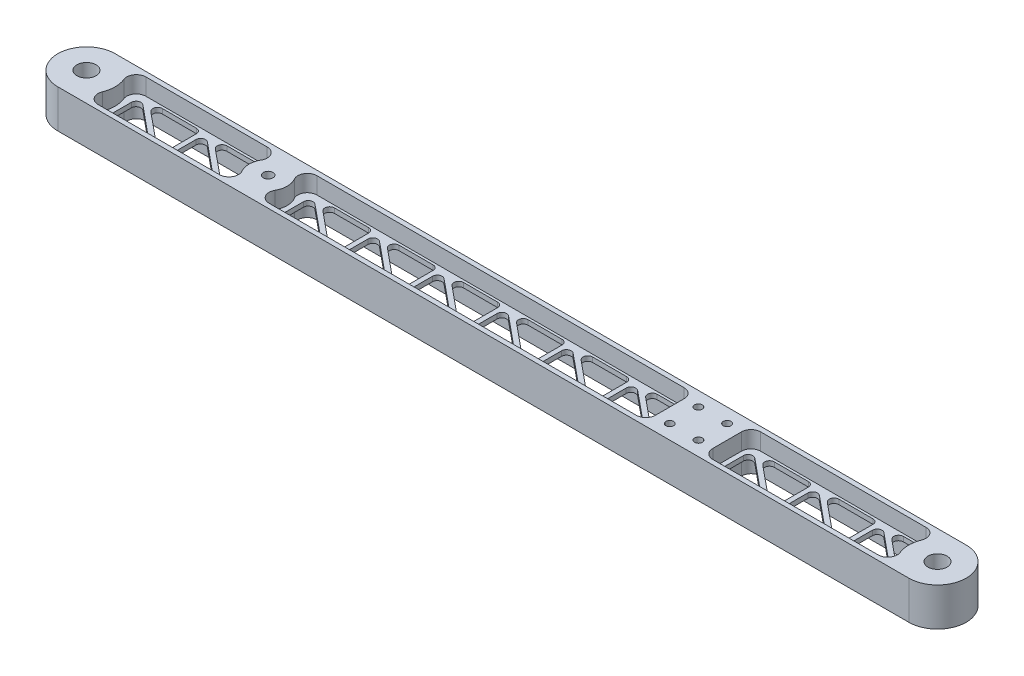
from build123d import *

# Parameters (mm, degrees)
SKETCH2_R                   = 6.35
SKETCH2_R_2                 = 3.175
BOSS_EXTRUDE1_DEPTH         = 25.4
CUT_EXTRUDE2_REACH          = 587.992
CUT_EXTRUDE3_DEPTH          = 11.1125
FILLET1_R                   = 3.175
F_1_4_20_TAPPED_HOLE1_D     = 5.1054
F_1_4_20_TAPPED_HOLE1_DEPTH = 19.05
F_1_4_20_TAPPED_HOLE1_TIP   = 1.533816902
FILLET3_R                   = 3.175
FILLET4_R                   = 3.175
FILLET5_R                   = 6.35
FILLET6_R                   = 3.175


with BuildPart() as part:
    # Sketch2 → Boss-Extrude1 (new body)
    with BuildSketch(Plane(origin=(0, 0, 0), x_dir=(1, 0, 0), z_dir=(0, 1, 0))):
        with BuildLine():
            ThreePointArc((0, 38.1), (-19.05, 19.05), (0, 0))
            Line((0, 0), (565.15, 0))
            ThreePointArc((565.15, 0), (584.2, 19.05), (565.15, 38.1))
            Line((565.15, 38.1), (0, 38.1))
        make_face()
        with Locations(Location((0, 19.05, 0), (0, 0, 270))):
            Circle(SKETCH2_R, mode=Mode.SUBTRACT)
        with Locations(Location((120.65, 19.05, 0), (0, 0, 270))):
            Circle(SKETCH2_R_2, mode=Mode.SUBTRACT)
        with Locations(Location((565.15, 19.05, 0), (0, 0, 270))):
            Circle(SKETCH2_R, mode=Mode.SUBTRACT)
    extrude(amount=BOSS_EXTRUDE1_DEPTH)

    # Sketch13 → Cut-Extrude2 (cut, up to next)
    with BuildSketch(Plane(origin=(0, 25.4, 0), x_dir=(1, 0, 0), z_dir=(0, 1, 0)), mode=Mode.PRIVATE) as cut_extrude2_sk1:
        Polygon((56.91846966, 4.7625), (22.225, 33.3375), (22.225, 4.7625), align=None)
    cut_extrude2_tool1 = extrude(cut_extrude2_sk1.sketch, amount=-CUT_EXTRUDE2_REACH, mode=Mode.PRIVATE) & part.part
    # Sketch13 → Cut-Extrude2 (cut, up to next)
    with BuildSketch(Plane(origin=(0, 25.4, 0), x_dir=(1, 0, 0), z_dir=(0, 1, 0)), mode=Mode.PRIVATE) as cut_extrude2_sk2:
        Polygon((61.9125, 33.3375), (27.21903034, 33.3375), (61.9125, 4.7625), align=None)
    cut_extrude2_tool2 = extrude(cut_extrude2_sk2.sketch, amount=-CUT_EXTRUDE2_REACH, mode=Mode.PRIVATE) & part.part
    # Sketch13 → Cut-Extrude2 (cut, up to next)
    with BuildSketch(Plane(origin=(0, 25.4, 0), x_dir=(1, 0, 0), z_dir=(0, 1, 0)), mode=Mode.PRIVATE) as cut_extrude2_sk3:
        Polygon((99.78096966, 4.7625), (65.0875, 33.3375), (65.0875, 4.7625), align=None)
    cut_extrude2_tool3 = extrude(cut_extrude2_sk3.sketch, amount=-CUT_EXTRUDE2_REACH, mode=Mode.PRIVATE) & part.part
    # Sketch13 → Cut-Extrude2 (cut, up to next)
    with BuildSketch(Plane(origin=(0, 25.4, 0), x_dir=(1, 0, 0), z_dir=(0, 1, 0)), mode=Mode.PRIVATE) as cut_extrude2_sk4:
        Polygon((104.775, 33.3375), (70.08153034, 33.3375), (104.775, 4.7625), align=None)
    cut_extrude2_tool4 = extrude(cut_extrude2_sk4.sketch, amount=-CUT_EXTRUDE2_REACH, mode=Mode.PRIVATE) & part.part
    # Sketch13 → Cut-Extrude2 (cut, up to next)
    with BuildSketch(Plane(origin=(0, 25.4, 0), x_dir=(1, 0, 0), z_dir=(0, 1, 0)), mode=Mode.PRIVATE) as cut_extrude2_sk5:
        Polygon((384.175, 5.879333612), (350.8375, 33.3375), (350.8375, 4.7625), (384.175, 4.7625), align=None)
    cut_extrude2_tool5 = extrude(cut_extrude2_sk5.sketch, amount=-CUT_EXTRUDE2_REACH, mode=Mode.PRIVATE) & part.part
    # Sketch13 → Cut-Extrude2 (cut, up to next)
    with BuildSketch(Plane(origin=(0, 25.4, 0), x_dir=(1, 0, 0), z_dir=(0, 1, 0)), mode=Mode.PRIVATE) as cut_extrude2_sk6:
        Polygon((384.175, 33.3375), (355.83153034, 33.3375), (384.175, 9.992626931), align=None)
    cut_extrude2_tool6 = extrude(cut_extrude2_sk6.sketch, amount=-CUT_EXTRUDE2_REACH, mode=Mode.PRIVATE) & part.part
    # Sketch13 → Cut-Extrude2 (cut, up to next)
    with BuildSketch(Plane(origin=(0, 25.4, 0), x_dir=(1, 0, 0), z_dir=(0, 1, 0)), mode=Mode.PRIVATE) as cut_extrude2_sk7:
        Polygon((171.21846966, 4.7625), (136.525, 33.3375), (136.525, 4.7625), align=None)
    cut_extrude2_tool7 = extrude(cut_extrude2_sk7.sketch, amount=-CUT_EXTRUDE2_REACH, mode=Mode.PRIVATE) & part.part
    # Sketch13 → Cut-Extrude2 (cut, up to next)
    with BuildSketch(Plane(origin=(0, 25.4, 0), x_dir=(1, 0, 0), z_dir=(0, 1, 0)), mode=Mode.PRIVATE) as cut_extrude2_sk8:
        Polygon((176.2125, 33.3375), (141.51903034, 33.3375), (176.2125, 4.7625), align=None)
    cut_extrude2_tool8 = extrude(cut_extrude2_sk8.sketch, amount=-CUT_EXTRUDE2_REACH, mode=Mode.PRIVATE) & part.part
    # Sketch13 → Cut-Extrude2 (cut, up to next)
    with BuildSketch(Plane(origin=(0, 25.4, 0), x_dir=(1, 0, 0), z_dir=(0, 1, 0)), mode=Mode.PRIVATE) as cut_extrude2_sk9:
        Polygon((214.08096966, 4.7625), (179.3875, 33.3375), (179.3875, 4.7625), align=None)
    cut_extrude2_tool9 = extrude(cut_extrude2_sk9.sketch, amount=-CUT_EXTRUDE2_REACH, mode=Mode.PRIVATE) & part.part
    # Sketch13 → Cut-Extrude2 (cut, up to next)
    with BuildSketch(Plane(origin=(0, 25.4, 0), x_dir=(1, 0, 0), z_dir=(0, 1, 0)), mode=Mode.PRIVATE) as cut_extrude2_sk10:
        Polygon((219.075, 33.3375), (184.38153034, 33.3375), (219.075, 4.7625), align=None)
    cut_extrude2_tool10 = extrude(cut_extrude2_sk10.sketch, amount=-CUT_EXTRUDE2_REACH, mode=Mode.PRIVATE) & part.part
    # Sketch13 → Cut-Extrude2 (cut, up to next)
    with BuildSketch(Plane(origin=(0, 25.4, 0), x_dir=(1, 0, 0), z_dir=(0, 1, 0)), mode=Mode.PRIVATE) as cut_extrude2_sk11:
        Polygon((256.94346966, 4.7625), (222.25, 33.3375), (222.25, 4.7625), align=None)
    cut_extrude2_tool11 = extrude(cut_extrude2_sk11.sketch, amount=-CUT_EXTRUDE2_REACH, mode=Mode.PRIVATE) & part.part
    # Sketch13 → Cut-Extrude2 (cut, up to next)
    with BuildSketch(Plane(origin=(0, 25.4, 0), x_dir=(1, 0, 0), z_dir=(0, 1, 0)), mode=Mode.PRIVATE) as cut_extrude2_sk12:
        Polygon((261.9375, 33.3375), (227.24403034, 33.3375), (261.9375, 4.7625), align=None)
    cut_extrude2_tool12 = extrude(cut_extrude2_sk12.sketch, amount=-CUT_EXTRUDE2_REACH, mode=Mode.PRIVATE) & part.part
    # Sketch13 → Cut-Extrude2 (cut, up to next)
    with BuildSketch(Plane(origin=(0, 25.4, 0), x_dir=(1, 0, 0), z_dir=(0, 1, 0)), mode=Mode.PRIVATE) as cut_extrude2_sk13:
        Polygon((299.80596966, 4.7625), (265.1125, 33.3375), (265.1125, 4.7625), align=None)
    cut_extrude2_tool13 = extrude(cut_extrude2_sk13.sketch, amount=-CUT_EXTRUDE2_REACH, mode=Mode.PRIVATE) & part.part
    # Sketch13 → Cut-Extrude2 (cut, up to next)
    with BuildSketch(Plane(origin=(0, 25.4, 0), x_dir=(1, 0, 0), z_dir=(0, 1, 0)), mode=Mode.PRIVATE) as cut_extrude2_sk14:
        Polygon((304.8, 33.3375), (270.10653034, 33.3375), (304.8, 4.7625), align=None)
    cut_extrude2_tool14 = extrude(cut_extrude2_sk14.sketch, amount=-CUT_EXTRUDE2_REACH, mode=Mode.PRIVATE) & part.part
    # Sketch13 → Cut-Extrude2 (cut, up to next)
    with BuildSketch(Plane(origin=(0, 25.4, 0), x_dir=(1, 0, 0), z_dir=(0, 1, 0)), mode=Mode.PRIVATE) as cut_extrude2_sk15:
        Polygon((342.66846966, 4.7625), (307.975, 33.3375), (307.975, 4.7625), align=None)
    cut_extrude2_tool15 = extrude(cut_extrude2_sk15.sketch, amount=-CUT_EXTRUDE2_REACH, mode=Mode.PRIVATE) & part.part
    # Sketch13 → Cut-Extrude2 (cut, up to next)
    with BuildSketch(Plane(origin=(0, 25.4, 0), x_dir=(1, 0, 0), z_dir=(0, 1, 0)), mode=Mode.PRIVATE) as cut_extrude2_sk16:
        Polygon((347.6625, 33.3375), (312.96903034, 33.3375), (347.6625, 4.7625), align=None)
    cut_extrude2_tool16 = extrude(cut_extrude2_sk16.sketch, amount=-CUT_EXTRUDE2_REACH, mode=Mode.PRIVATE) & part.part
    # Sketch13 → Cut-Extrude2 (cut, up to next)
    with BuildSketch(Plane(origin=(0, 25.4, 0), x_dir=(1, 0, 0), z_dir=(0, 1, 0)), mode=Mode.PRIVATE) as cut_extrude2_sk17:
        with BuildLine():
            ThreePointArc((543.684455535, 13.289702626), (543.4511385, 23.857289738), (548.125959095, 33.3375))
            Line((548.125959095, 33.3375), (519.34403034, 33.3375))
            Line((519.34403034, 33.3375), (543.684455535, 13.289702626))
        make_face()
    cut_extrude2_tool17 = extrude(cut_extrude2_sk17.sketch, amount=-CUT_EXTRUDE2_REACH, mode=Mode.PRIVATE) & part.part
    # Sketch13 → Cut-Extrude2 (cut, up to next)
    with BuildSketch(Plane(origin=(0, 25.4, 0), x_dir=(1, 0, 0), z_dir=(0, 1, 0)), mode=Mode.PRIVATE) as cut_extrude2_sk18:
        with BuildLine():
            ThreePointArc((548.125959095, 4.7625), (547.360233209, 5.728032333), (546.649199715, 6.734521373))
            Line((546.649199715, 6.734521373), (514.35, 33.3375))
            Line((514.35, 33.3375), (514.35, 4.7625))
            Line((514.35, 4.7625), (548.125959095, 4.7625))
        make_face()
    cut_extrude2_tool18 = extrude(cut_extrude2_sk18.sketch, amount=-CUT_EXTRUDE2_REACH, mode=Mode.PRIVATE) & part.part
    # Sketch13 → Cut-Extrude2 (cut, up to next)
    with BuildSketch(Plane(origin=(0, 25.4, 0), x_dir=(1, 0, 0), z_dir=(0, 1, 0)), mode=Mode.PRIVATE) as cut_extrude2_sk19:
        Polygon((463.31846966, 4.7625), (428.625, 33.3375), (428.625, 4.7625), align=None)
    cut_extrude2_tool19 = extrude(cut_extrude2_sk19.sketch, amount=-CUT_EXTRUDE2_REACH, mode=Mode.PRIVATE) & part.part
    # Sketch13 → Cut-Extrude2 (cut, up to next)
    with BuildSketch(Plane(origin=(0, 25.4, 0), x_dir=(1, 0, 0), z_dir=(0, 1, 0)), mode=Mode.PRIVATE) as cut_extrude2_sk20:
        Polygon((468.3125, 33.3375), (433.61903034, 33.3375), (468.3125, 4.7625), align=None)
    cut_extrude2_tool20 = extrude(cut_extrude2_sk20.sketch, amount=-CUT_EXTRUDE2_REACH, mode=Mode.PRIVATE) & part.part
    # Sketch13 → Cut-Extrude2 (cut, up to next)
    with BuildSketch(Plane(origin=(0, 25.4, 0), x_dir=(1, 0, 0), z_dir=(0, 1, 0)), mode=Mode.PRIVATE) as cut_extrude2_sk21:
        Polygon((506.18096966, 4.7625), (471.4875, 33.3375), (471.4875, 4.7625), align=None)
    cut_extrude2_tool21 = extrude(cut_extrude2_sk21.sketch, amount=-CUT_EXTRUDE2_REACH, mode=Mode.PRIVATE) & part.part
    # Sketch13 → Cut-Extrude2 (cut, up to next)
    with BuildSketch(Plane(origin=(0, 25.4, 0), x_dir=(1, 0, 0), z_dir=(0, 1, 0)), mode=Mode.PRIVATE) as cut_extrude2_sk22:
        Polygon((511.175, 33.3375), (476.48153034, 33.3375), (511.175, 4.7625), align=None)
    cut_extrude2_tool22 = extrude(cut_extrude2_sk22.sketch, amount=-CUT_EXTRUDE2_REACH, mode=Mode.PRIVATE) & part.part
    add(cut_extrude2_tool1.solids().sort_by_distance((33.78949, 25.4, -14.2875))[0], mode=Mode.SUBTRACT)
    add(cut_extrude2_tool2.solids().sort_by_distance((50.34801, 25.4, -23.8125))[0], mode=Mode.SUBTRACT)
    add(cut_extrude2_tool3.solids().sort_by_distance((76.65199, 25.4, -14.2875))[0], mode=Mode.SUBTRACT)
    add(cut_extrude2_tool4.solids().sort_by_distance((93.21051, 25.4, -23.8125))[0], mode=Mode.SUBTRACT)
    add(cut_extrude2_tool5.solids().sort_by_distance((362.367987, 25.4, -14.301503))[0], mode=Mode.SUBTRACT)
    add(cut_extrude2_tool6.solids().sort_by_distance((374.727177, 25.4, -25.555876))[0], mode=Mode.SUBTRACT)
    add(cut_extrude2_tool7.solids().sort_by_distance((148.08949, 25.4, -14.2875))[0], mode=Mode.SUBTRACT)
    add(cut_extrude2_tool8.solids().sort_by_distance((164.64801, 25.4, -23.8125))[0], mode=Mode.SUBTRACT)
    add(cut_extrude2_tool9.solids().sort_by_distance((190.95199, 25.4, -14.2875))[0], mode=Mode.SUBTRACT)
    add(cut_extrude2_tool10.solids().sort_by_distance((207.51051, 25.4, -23.8125))[0], mode=Mode.SUBTRACT)
    add(cut_extrude2_tool11.solids().sort_by_distance((233.81449, 25.4, -14.2875))[0], mode=Mode.SUBTRACT)
    add(cut_extrude2_tool12.solids().sort_by_distance((250.37301, 25.4, -23.8125))[0], mode=Mode.SUBTRACT)
    add(cut_extrude2_tool13.solids().sort_by_distance((276.67699, 25.4, -14.2875))[0], mode=Mode.SUBTRACT)
    add(cut_extrude2_tool14.solids().sort_by_distance((293.23551, 25.4, -23.8125))[0], mode=Mode.SUBTRACT)
    add(cut_extrude2_tool15.solids().sort_by_distance((319.53949, 25.4, -14.2875))[0], mode=Mode.SUBTRACT)
    add(cut_extrude2_tool16.solids().sort_by_distance((336.09801, 25.4, -23.8125))[0], mode=Mode.SUBTRACT)
    add(cut_extrude2_tool17.solids().sort_by_distance((535.971737, 25.4, -27.083486))[0], mode=Mode.SUBTRACT)
    add(cut_extrude2_tool18.solids().sort_by_distance((525.871779, 25.4, -14.304685))[0], mode=Mode.SUBTRACT)
    add(cut_extrude2_tool19.solids().sort_by_distance((440.18949, 25.4, -14.2875))[0], mode=Mode.SUBTRACT)
    add(cut_extrude2_tool20.solids().sort_by_distance((456.74801, 25.4, -23.8125))[0], mode=Mode.SUBTRACT)
    add(cut_extrude2_tool21.solids().sort_by_distance((483.05199, 25.4, -14.2875))[0], mode=Mode.SUBTRACT)
    add(cut_extrude2_tool22.solids().sort_by_distance((499.61051, 25.4, -23.8125))[0], mode=Mode.SUBTRACT)

    # Sketch13<4> → Cut-Extrude3 (cut)
    # profile 1 of 3: a face of its own
    with BuildSketch(Plane(origin=(0, 25.4, 0), x_dir=(1, 0, 0), z_dir=(0, 1, 0))):
        with BuildLine():
            ThreePointArc((109.651477372, 25.4), (109.651477372, 31.75), (104.152216058, 34.925))
            Line((104.152216058, 34.925), (10.530283709, 34.925))
            ThreePointArc((10.530283709, 34.925), (16.785475934, 28.058346001), (19.05, 19.05))
            ThreePointArc((19.05, 19.05), (16.785475934, 10.041653999), (10.530283709, 3.175))
            Line((10.530283709, 3.175), (104.152216058, 3.175))
            ThreePointArc((104.152216058, 3.175), (109.651477372, 6.35), (109.651477372, 12.7))
            ThreePointArc((109.651477372, 12.7), (107.95, 19.05), (109.651477372, 25.4))
        make_face()
        Polygon((22.225, 4.7625), (22.225, 33.3375), (56.91846966, 4.7625), align=None, mode=Mode.SUBTRACT)
        Polygon((61.9125, 4.7625), (27.21903034, 33.3375), (61.9125, 33.3375), align=None, mode=Mode.SUBTRACT)
        Polygon((65.0875, 4.7625), (65.0875, 33.3375), (99.78096966, 4.7625), align=None, mode=Mode.SUBTRACT)
        Polygon((104.775, 4.7625), (70.08153034, 33.3375), (104.775, 33.3375), align=None, mode=Mode.SUBTRACT)
    # profile 2 of 3: a face of its own
    with BuildSketch(Plane(origin=(0, 25.4, 0), x_dir=(1, 0, 0), z_dir=(0, 1, 0))):
        with BuildLine():
            Line((554.619716291, 34.925), (425.45, 34.925))
            Line((425.45, 34.925), (425.45, 3.175))
            Line((425.45, 3.175), (550.970884641, 3.175))
            Line((550.970884641, 3.175), (554.619716291, 3.175))
            ThreePointArc((554.619716291, 3.175), (546.1, 19.05), (554.619716291, 34.925))
        make_face()
        Polygon((428.625, 4.7625), (428.625, 33.3375), (463.31846966, 4.7625), align=None, mode=Mode.SUBTRACT)
        Polygon((468.3125, 4.7625), (433.61903034, 33.3375), (468.3125, 33.3375), align=None, mode=Mode.SUBTRACT)
        Polygon((471.4875, 4.7625), (471.4875, 33.3375), (506.18096966, 4.7625), align=None, mode=Mode.SUBTRACT)
        Polygon((511.175, 4.7625), (476.48153034, 33.3375), (511.175, 33.3375), align=None, mode=Mode.SUBTRACT)
        with BuildLine():
            Line((514.35, 33.3375), (546.649199715, 6.734521373))
            ThreePointArc((546.649199715, 6.734521373), (547.360233209, 5.728032333), (548.125959095, 4.7625))
            Line((548.125959095, 4.7625), (514.35, 4.7625))
            Line((514.35, 4.7625), (514.35, 33.3375))
        make_face(mode=Mode.SUBTRACT)
        with BuildLine():
            Line((519.34403034, 33.3375), (548.125959095, 33.3375))
            ThreePointArc((548.125959095, 33.3375), (543.4511385, 23.857289738), (543.684455535, 13.289702626))
            Line((543.684455535, 13.289702626), (519.34403034, 33.3375))
        make_face(mode=Mode.SUBTRACT)
    # profile 3 of 3: a face of its own
    with BuildSketch(Plane(origin=(0, 25.4, 0), x_dir=(1, 0, 0), z_dir=(0, 1, 0))):
        with BuildLine():
            Line((387.35, 34.925), (137.147783942, 34.925))
            ThreePointArc((137.147783942, 34.925), (131.648522628, 31.75), (131.648522628, 25.4))
            ThreePointArc((131.648522628, 25.4), (133.35, 19.05), (131.648522628, 12.7))
            ThreePointArc((131.648522628, 12.7), (131.648522628, 6.35), (137.147783942, 3.175))
            Line((137.147783942, 3.175), (387.35, 3.175))
            Line((387.35, 3.175), (387.35, 34.925))
        make_face()
        Polygon((136.525, 4.7625), (136.525, 33.3375), (171.21846966, 4.7625), align=None, mode=Mode.SUBTRACT)
        Polygon((176.2125, 4.7625), (141.51903034, 33.3375), (176.2125, 33.3375), align=None, mode=Mode.SUBTRACT)
        Polygon((179.3875, 4.7625), (179.3875, 33.3375), (214.08096966, 4.7625), align=None, mode=Mode.SUBTRACT)
        Polygon((219.075, 4.7625), (184.38153034, 33.3375), (219.075, 33.3375), align=None, mode=Mode.SUBTRACT)
        Polygon((222.25, 4.7625), (222.25, 33.3375), (256.94346966, 4.7625), align=None, mode=Mode.SUBTRACT)
        Polygon((261.9375, 4.7625), (227.24403034, 33.3375), (261.9375, 33.3375), align=None, mode=Mode.SUBTRACT)
        Polygon((265.1125, 4.7625), (265.1125, 33.3375), (299.80596966, 4.7625), align=None, mode=Mode.SUBTRACT)
        Polygon((304.8, 4.7625), (270.10653034, 33.3375), (304.8, 33.3375), align=None, mode=Mode.SUBTRACT)
        Polygon((307.975, 4.7625), (307.975, 33.3375), (342.66846966, 4.7625), align=None, mode=Mode.SUBTRACT)
        Polygon((347.6625, 4.7625), (312.96903034, 33.3375), (347.6625, 33.3375), align=None, mode=Mode.SUBTRACT)
        Polygon((350.8375, 4.7625), (350.8375, 33.3375), (384.175, 5.879333612), (384.175, 4.7625), align=None, mode=Mode.SUBTRACT)
        Polygon((384.175, 9.992626931), (355.83153034, 33.3375), (384.175, 33.3375), align=None, mode=Mode.SUBTRACT)
    cut_extrude3 = extrude(amount=-CUT_EXTRUDE3_DEPTH, mode=Mode.SUBTRACT)

    # Mirror1: Cut-Extrude3 across plane
    add(cut_extrude3.mirror(Plane(origin=(0, 12.7, 0), x_dir=(0, 0, 1), z_dir=(0, -1, 0))), mode=Mode.SUBTRACT)

    # Fillet1
    fillet1_edges = [part.edges().sort_by_distance(p)[0] for p in [
        (70.08153034, 12.7, -33.3375),
        (104.775, 12.7, -33.3375),
        (104.775, 12.7, -4.7625),
        (65.0875, 12.7, -33.3375),
        (99.78096966, 12.7, -4.7625),
        (65.0875, 12.7, -4.7625),
        (27.21903034, 12.7, -33.3375),
        (61.9125, 12.7, -33.3375),
        (61.9125, 12.7, -4.7625),
        (22.225, 12.7, -33.3375),
        (56.91846966, 12.7, -4.7625),
        (22.225, 12.7, -4.7625),
        (471.4875, 12.7, -33.3375),
        (506.18096966, 12.7, -4.7625),
        (471.4875, 12.7, -4.7625),
        (476.48153034, 12.7, -33.3375),
        (511.175, 12.7, -33.3375),
        (511.175, 12.7, -4.7625),
        (514.35, 12.7, -33.3375),
        (514.35, 12.7, -4.7625),
        (548.125959095, 12.7, -33.3375),
        (543.684455535, 12.7, -13.289702626),
        (433.61903034, 12.7, -33.3375),
        (468.3125, 12.7, -33.3375),
        (468.3125, 12.7, -4.7625),
        (428.625, 12.7, -33.3375),
        (463.31846966, 12.7, -4.7625),
        (428.625, 12.7, -4.7625),
        (265.1125, 12.7, -33.3375),
        (299.80596966, 12.7, -4.7625),
        (265.1125, 12.7, -4.7625),
        (355.83153034, 12.7, -33.3375),
        (384.175, 12.7, -33.3375),
        (384.175, 12.7, -9.992626931),
        (350.8375, 12.7, -33.3375),
        (350.8375, 12.7, -4.7625),
        (312.96903034, 12.7, -33.3375),
        (347.6625, 12.7, -33.3375),
        (347.6625, 12.7, -4.7625),
        (307.975, 12.7, -33.3375),
        (342.66846966, 12.7, -4.7625),
        (307.975, 12.7, -4.7625),
        (270.10653034, 12.7, -33.3375),
        (304.8, 12.7, -33.3375),
        (304.8, 12.7, -4.7625),
        (227.24403034, 12.7, -33.3375),
        (261.9375, 12.7, -33.3375),
        (261.9375, 12.7, -4.7625),
        (222.25, 12.7, -33.3375),
        (256.94346966, 12.7, -4.7625),
        (222.25, 12.7, -4.7625),
        (184.38153034, 12.7, -33.3375),
        (219.075, 12.7, -33.3375),
        (219.075, 12.7, -4.7625),
        (179.3875, 12.7, -33.3375),
        (214.08096966, 12.7, -4.7625),
        (179.3875, 12.7, -4.7625),
        (141.51903034, 12.7, -33.3375),
        (176.2125, 12.7, -33.3375),
        (176.2125, 12.7, -4.7625),
        (136.525, 12.7, -33.3375),
        (171.21846966, 12.7, -4.7625),
        (136.525, 12.7, -4.7625),
    ]]
    fillet(fillet1_edges, radius=FILLET1_R)

    # 1/4-20 Tapped Hole1
    with Locations(Plane(origin=(415.925, 25.4, -28.575), x_dir=(0, 0, 1), z_dir=(0, 1, 0))):
        with Locations((0, 0), (0, -19.05), (19.05, -19.05), (19.05, 0)):
            Hole(F_1_4_20_TAPPED_HOLE1_D / 2, depth=F_1_4_20_TAPPED_HOLE1_DEPTH)
            with Locations((0, 0, -(F_1_4_20_TAPPED_HOLE1_DEPTH + F_1_4_20_TAPPED_HOLE1_TIP / 2))):  # 118° drill point
                Cone(0, F_1_4_20_TAPPED_HOLE1_D / 2, F_1_4_20_TAPPED_HOLE1_TIP, mode=Mode.SUBTRACT)

    # Fillet3
    # the kernel refuses this fillet: 3.175 mm, written as the material it adds along each edge
    with BuildSketch(Plane(origin=(548.125959095, 14.2875, -4.7625), x_dir=(-1, 0, 0), z_dir=(0, -1, 0))) as fillet3_piece_1:
        with BuildLine():
            CenterArc((7.931349737, 3.175), FILLET3_R, 129.476304775, 140.523695225)
            Line((5.912814743, 5.625743047), (5.710961244, 5.870817351))
            ThreePointArc((5.710961244, 5.870817351), (1.274905881, 2.217095678), (-0.243200584, 0.204107143))
            Line((-0.243200584, 0.204107143), (0, -0.3175))
            Line((0, -0.3175), (7.931349737, -0.3175))
            Line((7.931349737, -0.3175), (7.931349737, 0))
        make_face()
    extrude(amount=3.175)

    # Fillet4
    fillet4_edges = [part.edges().sort_by_distance(p)[0] for p in [
        (519.34403034, 12.7, -33.3375),
    ]]
    fillet(fillet4_edges, radius=FILLET4_R)

    # Fillet5
    fillet5_edges = [part.edges().sort_by_distance(p)[0] for p in [
        (10.530283709, 19.84375, -3.175),
        (10.530283709, 19.84375, -34.925),
        (554.619716291, 19.84375, -34.925),
        (554.619716291, 19.84375, -3.175),
        (425.45, 19.84375, -3.175),
        (425.45, 19.84375, -34.925),
        (387.35, 19.84375, -34.925),
        (387.35, 19.84375, -3.175),
        (10.530283709, 5.55625, -34.925),
        (10.530283709, 5.55625, -3.175),
        (554.619716291, 5.55625, -3.175),
        (554.619716291, 5.55625, -34.925),
        (425.45, 5.55625, -34.925),
        (425.45, 5.55625, -3.175),
        (387.35, 5.55625, -3.175),
        (387.35, 5.55625, -34.925),
    ]]
    fillet(fillet5_edges, radius=FILLET5_R)

    # Fillet6
    # the kernel refuses this fillet: 3.175 mm, written as the material it adds along each edge
    with BuildSketch(Plane(origin=(384.175, 14.2875, -5.879333612), x_dir=(-0.7718875737059745, 0, -0.6357590530683018), z_dir=(0, -1, 0))) as fillet6_piece_1:
        with BuildLine():
            CenterArc((7.092167092, -3.175), FILLET6_R, 90, 140.523695225)
            Line((5.073632098, -5.625743047), (4.871778599, -5.870817351))
            ThreePointArc((4.871778599, -5.870817351), (-0.911890579, -1.107144292), (-0.245074305, 0.201853499))
            Line((-0.245074305, 0.201853499), (0, 0.3175))
            Line((0, 0.3175), (7.092167092, 0.3175))
            Line((7.092167092, 0.3175), (7.092167092, 0))
        make_face()
    extrude(amount=3.175)
    with BuildSketch(Plane(origin=(384.175, 14.2875, -4.7625), x_dir=(-1, 0, 0), z_dir=(0, -1, 0))) as fillet6_piece_2:
        with BuildLine():
            CenterArc((7.492890642, 3.175), FILLET6_R, 129.476304775, 140.523695225)
            Line((5.474355649, 5.625743047), (5.27250215, 5.870817351))
            ThreePointArc((5.27250215, 5.870817351), (-0.201853499, 1.361907917), (-0.3175, 0))
            Line((-0.3175, 0), (0, -0.3175))
            Line((0, -0.3175), (7.492890642, -0.3175))
            Line((7.492890642, -0.3175), (7.492890642, 0))
        make_face()
    extrude(amount=3.175)


solid = part.part
